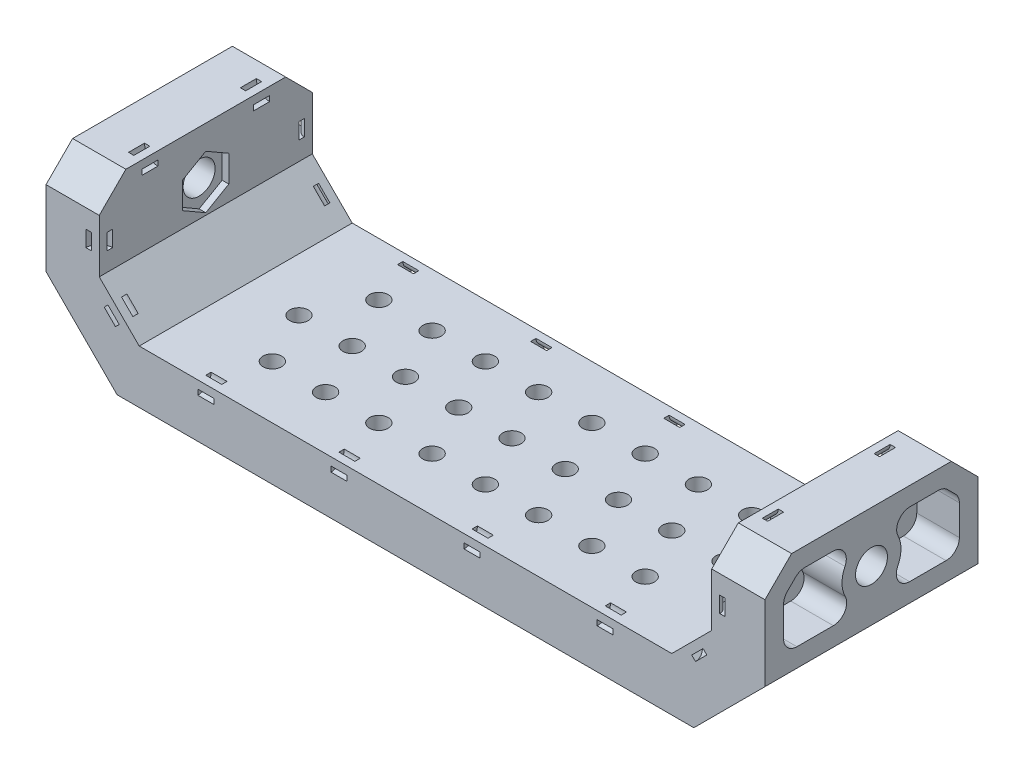
from build123d import *

# Parameters (mm, degrees)
EXTRUDE_1_DEPTH          = 40
EXTRUDE_1_DEPTH_BACK     = 40
CHAMFER_1_SIZE           = 10
SKETCH_2_R               = 3.5
CUT_EXTRUDE_3_DEPTH      = 30
CUT_EXTRUDE_8_DEPTH      = 12
SKETCH_6_R               = 6
CUT_EXTRUDE_9_DEPTH      = 22
CUT_EXTRUDE_10_DEPTH     = 2.5
CUT_EXTRUDE_11_DEPTH     = 16
CUT_EXTRUDE_12_DEPTH     = 17
CUT_EXTRUDE_13_DEPTH     = 8
SKETCH_10_W              = 6
SKETCH_10_H              = 2
SKETCH_12_W              = 2
SKETCH_12_H              = 6
SKETCH_13_W              = 2
SKETCH_13_H              = 6
MIRROR_4_COPY_2_SKETCH_W = 2
MIRROR_4_COPY_2_SKETCH_H = 6


with BuildPart() as part:
    # Эскиз1 → Бобышка-Вытянуть1 (new, two sides: drawn at the far end of the back side and taken through both)
    with BuildSketch(Plane.XY.offset(-EXTRUDE_1_DEPTH_BACK)):
        Polygon((-100, 0), (100, 0), (115, 15), (115, 45), (135, 45), (135, 6.715728753), (108.284271247, -20), (-108.284271247, -20), (-135, 6.715728753), (-135, 45), (-115, 45), (-115, 15), align=None)
    extrude(amount=EXTRUDE_1_DEPTH + EXTRUDE_1_DEPTH_BACK)

    # Фаска1
    chamfer_1_edges = [part.edges().sort_by_distance(p)[0] for p in [
        (125, 45, 40),
        (125, 45, -40),
        (-125, 45, -40),
        (-125, 45, 40),
    ]]
    chamfer(chamfer_1_edges, length=CHAMFER_1_SIZE)

    # Эскиз2 → Вырез-Вытянуть3 (cut)
    with BuildSketch(Plane(origin=(0, 0, 0), x_dir=(1, 0, 0), z_dir=(0, 1, 0))):
        Circle(SKETCH_2_R)
        with Locations((20, 0)):
            Circle(SKETCH_2_R)
        with Locations((40, 0)):
            Circle(SKETCH_2_R)
        with Locations((60, 0)):
            Circle(SKETCH_2_R)
        with Locations((80, 0)):
            Circle(SKETCH_2_R)
        with Locations((-20, 0)):
            Circle(SKETCH_2_R)
        with Locations((-40, 0)):
            Circle(SKETCH_2_R)
        with Locations((-60, 0)):
            Circle(SKETCH_2_R)
        with Locations((-80, 0)):
            Circle(SKETCH_2_R)
        with Locations((10, -20)):
            Circle(SKETCH_2_R)
        with Locations((30, -20)):
            Circle(SKETCH_2_R)
        with Locations((50, -20)):
            Circle(SKETCH_2_R)
        with Locations((70, -20)):
            Circle(SKETCH_2_R)
        with Locations((30, 20)):
            Circle(SKETCH_2_R)
        with Locations((50, 20)):
            Circle(SKETCH_2_R)
        with Locations((70, 20)):
            Circle(SKETCH_2_R)
        with Locations((10, 20)):
            Circle(SKETCH_2_R)
        with Locations((-70, 20)):
            Circle(SKETCH_2_R)
        with Locations((-50, 20)):
            Circle(SKETCH_2_R)
        with Locations((-30, 20)):
            Circle(SKETCH_2_R)
        with Locations((-10, 20)):
            Circle(SKETCH_2_R)
        with Locations((-10, -20)):
            Circle(SKETCH_2_R)
        with Locations((-30, -20)):
            Circle(SKETCH_2_R)
        with Locations((-50, -20)):
            Circle(SKETCH_2_R)
        with Locations((-70, -20)):
            Circle(SKETCH_2_R)
    extrude(amount=-CUT_EXTRUDE_3_DEPTH, mode=Mode.SUBTRACT)

    # Эскиз5 → Вырез-Вытянуть8 (cut)
    with BuildSketch(Plane(origin=(-64.142135624, -64.142135624, 0), x_dir=(0, 0, 1), z_dir=(-0.7071067811865483, -0.7071067811865468, 0))):
        with BuildLine():
            Line((-30, 93.208152802), (-5, 93.208152802))
            ThreePointArc((-5, 93.208152802), (-2.878679656, 92.329473145), (-2, 90.208152802))
            Line((-2, 90.208152802), (-2, 72.426406871))
            ThreePointArc((-2, 72.426406871), (-2.878679656, 70.305086528), (-5, 69.426406871))
            Line((-5, 69.426406871), (-30, 69.426406871))
            ThreePointArc((-30, 69.426406871), (-32.121320344, 70.305086528), (-33, 72.426406871))
            Line((-33, 72.426406871), (-33, 90.208152802))
            ThreePointArc((-33, 90.208152802), (-32.121320344, 92.329473145), (-30, 93.208152802))
        make_face()
        with BuildLine():
            Line((5, 93.208152802), (30, 93.208152802))
            ThreePointArc((30, 93.208152802), (32.121320344, 92.329473145), (33, 90.208152802))
            Line((33, 90.208152802), (33, 72.426406871))
            ThreePointArc((33, 72.426406871), (32.121320344, 70.305086528), (30, 69.426406871))
            Line((30, 69.426406871), (5, 69.426406871))
            ThreePointArc((5, 69.426406871), (2.878679656, 70.305086528), (2, 72.426406871))
            Line((2, 72.426406871), (2, 90.208152802))
            ThreePointArc((2, 90.208152802), (2.878679656, 92.329473145), (5, 93.208152802))
        make_face()
    cut_extrude_8 = extrude(amount=-CUT_EXTRUDE_8_DEPTH, mode=Mode.SUBTRACT)

    # Зеркальное отражение1: Вырез-Вытянуть8 across plane
    add(cut_extrude_8.mirror(Plane(origin=(0, 0, 0), x_dir=(0, 0, 1), z_dir=(1, 0, 0))), mode=Mode.SUBTRACT)

    # Эскиз6 → Вырез-Вытянуть9 (cut)
    with BuildSketch(Plane.ZY.offset(135)):
        with Locations((0, 26)):
            Circle(SKETCH_6_R)
    cut_extrude_9 = extrude(amount=-CUT_EXTRUDE_9_DEPTH, mode=Mode.SUBTRACT)

    # Эскиз7 → Вырез-Вытянуть10 (cut)
    with BuildSketch(Plane(origin=(-115, 0, 0), x_dir=(0, 0, -1), z_dir=(1, 0, 0))):
        Polygon((0, 35.857864376), (8.660254038, 30.857864376), (8.660254038, 20.857864376), (0, 15.857864376), (-8.660254038, 20.857864376), (-8.660254038, 30.857864376), align=None)
    cut_extrude_10 = extrude(amount=-CUT_EXTRUDE_10_DEPTH, mode=Mode.SUBTRACT)

    # Эскиз8 → Вырез-Вытянуть11 (cut)
    with BuildSketch(Plane.ZY.offset(135)):
        with BuildLine():
            Line((-25.029437252, 38), (-14.458578988, 38))
            ThreePointArc((-14.458578988, 38), (-10.222191502, 35.655752449), (-9.958260411, 30.821208428))
            ThreePointArc((-9.958260411, 30.821208428), (-11.063410697, 25.890707381), (-9.861071268, 20.983001438))
            ThreePointArc((-9.861071268, 20.983001438), (-10.055053298, 16.101954033), (-14.317468307, 13.715728753))
            Line((-14.317468307, 13.715728753), (-28, 13.715728753))
            ThreePointArc((-28, 13.715728753), (-31.535533906, 15.180194847), (-33, 18.715728753))
            Line((-33, 18.715728753), (-33, 30.029437252))
            ThreePointArc((-33, 30.029437252), (-32.619397663, 31.942854413), (-31.535533906, 33.564971157))
            Line((-31.535533906, 33.564971157), (-28.564971157, 36.535533906))
            ThreePointArc((-28.564971157, 36.535533906), (-26.942854413, 37.619397663), (-25.029437252, 38))
        make_face()
        with BuildLine():
            Line((14.458578988, 38), (25.029437252, 38))
            ThreePointArc((25.029437252, 38), (26.942854413, 37.619397663), (28.564971157, 36.535533906))
            Line((28.564971157, 36.535533906), (31.535533906, 33.564971157))
            ThreePointArc((31.535533906, 33.564971157), (32.619397663, 31.942854413), (33, 30.029437252))
            Line((33, 30.029437252), (33, 18.715728753))
            ThreePointArc((33, 18.715728753), (31.535533906, 15.180194847), (28, 13.715728753))
            Line((28, 13.715728753), (14.317468307, 13.715728753))
            ThreePointArc((14.317468307, 13.715728753), (10.055053298, 16.101954033), (9.861071268, 20.983001438))
            ThreePointArc((9.861071268, 20.983001438), (11.063410697, 25.890707381), (9.958260411, 30.821208428))
            ThreePointArc((9.958260411, 30.821208428), (10.222191502, 35.655752449), (14.458578988, 38))
        make_face()
    cut_extrude_11 = extrude(amount=-CUT_EXTRUDE_11_DEPTH, mode=Mode.SUBTRACT)

    # Зеркальное отражение2: Вырез-Вытянуть9, Вырез-Вытянуть10, Вырез-Вытянуть11 across plane
    add(cut_extrude_9.mirror(Plane(origin=(0, 0, 0), x_dir=(0, 0, 1), z_dir=(1, 0, 0))), mode=Mode.SUBTRACT)
    add(cut_extrude_10.mirror(Plane(origin=(0, 0, 0), x_dir=(0, 0, 1), z_dir=(1, 0, 0))), mode=Mode.SUBTRACT)
    add(cut_extrude_11.mirror(Plane(origin=(0, 0, 0), x_dir=(0, 0, 1), z_dir=(1, 0, 0))), mode=Mode.SUBTRACT)

    # Эскиз3 → Вырез-Вытянуть12 (cut)
    with BuildSketch(Plane.XZ.offset(20)):
        with BuildLine():
            Line((-90.284271247, 33), (-80.590169944, 33))
            ThreePointArc((-80.590169944, 33), (-79.012976607, 32.551952425), (-77.906888371, 31.341640786))
            Line((-77.906888371, 31.341640786), (-75.135494488, 25.798853021))
            ThreePointArc((-75.135494488, 25.798853021), (-74.819888616, 24.375517127), (-75.212517374, 22.971474823))
            ThreePointArc((-75.212517374, 22.971474823), (-76, 20), (-75.212517374, 17.028525177))
            ThreePointArc((-75.212517374, 17.028525177), (-74.819888616, 15.624482873), (-75.135494488, 14.201146979))
            Line((-75.135494488, 14.201146979), (-78.442214276, 7.587707403))
            ThreePointArc((-78.442214276, 7.587707403), (-79.391519468, 6.481221169), (-80.750330566, 5.952898793))
            ThreePointArc((-80.750330566, 5.952898793), (-83.154386673, 5.10390485), (-84.988876516, 3.333333333))
            ThreePointArc((-84.988876516, 3.333333333), (-86.069101211, 2.354248689), (-87.483314774, 2))
            Line((-87.483314774, 2), (-98.284271247, 2))
            ThreePointArc((-98.284271247, 2), (-100.405591591, 2.878679656), (-101.284271247, 5))
            Line((-101.284271247, 5), (-101.284271247, 22))
            ThreePointArc((-101.284271247, 22), (-98.062445841, 29.778174593), (-90.284271247, 33))
        make_face()
        with BuildLine():
            Line((-71.788854382, 28.049844719), (-74.263932023, 33))
            Line((-74.263932023, 33), (-65.736067977, 33))
            Line((-65.736067977, 33), (-68.211145618, 28.049844719))
            ThreePointArc((-68.211145618, 28.049844719), (-70, 26.94427191), (-71.788854382, 28.049844719))
        make_face()
        with BuildLine():
            Line((-61.788854382, 31.950155281), (-64.864505512, 25.798853021))
            ThreePointArc((-64.864505512, 25.798853021), (-65.180111384, 24.375517127), (-64.787482626, 22.971474823))
            ThreePointArc((-64.787482626, 22.971474823), (-64, 20), (-64.787482626, 17.028525177))
            ThreePointArc((-64.787482626, 17.028525177), (-65.180111384, 15.624482873), (-64.864505512, 14.201146979))
            Line((-64.864505512, 14.201146979), (-61.788854382, 8.049844719))
            ThreePointArc((-61.788854382, 8.049844719), (-60, 6.94427191), (-58.211145618, 8.049844719))
            Line((-58.211145618, 8.049844719), (-55.135494488, 14.201146979))
            ThreePointArc((-55.135494488, 14.201146979), (-54.819888616, 15.624482873), (-55.212517374, 17.028525177))
            ThreePointArc((-55.212517374, 17.028525177), (-56, 20), (-55.212517374, 22.971474823))
            ThreePointArc((-55.212517374, 22.971474823), (-54.819888616, 24.375517127), (-55.135494488, 25.798853021))
            Line((-55.135494488, 25.798853021), (-58.211145618, 31.950155281))
            ThreePointArc((-58.211145618, 31.950155281), (-60, 33.05572809), (-61.788854382, 31.950155281))
        make_face()
        with BuildLine():
            Line((-71.788854382, 11.950155281), (-74.593111629, 6.341640786))
            ThreePointArc((-74.593111629, 6.341640786), (-74.461782481, 3.422806664), (-71.909830056, 2))
            Line((-71.909830056, 2), (-68.090169944, 2))
            ThreePointArc((-68.090169944, 2), (-65.538217519, 3.422806664), (-65.406888371, 6.341640786))
            Line((-65.406888371, 6.341640786), (-68.211145618, 11.950155281))
            ThreePointArc((-68.211145618, 11.950155281), (-70, 13.05572809), (-71.788854382, 11.950155281))
        make_face()
        with BuildLine():
            Line((-78.442214276, -7.587707403), (-75.135494488, -14.201146979))
            ThreePointArc((-75.135494488, -14.201146979), (-74.819888616, -15.624482873), (-75.212517374, -17.028525177))
            ThreePointArc((-75.212517374, -17.028525177), (-76, -20), (-75.212517374, -22.971474823))
            ThreePointArc((-75.212517374, -22.971474823), (-74.819888616, -24.375517127), (-75.135494488, -25.798853021))
            Line((-75.135494488, -25.798853021), (-78.736067978, -33))
            Line((-78.736067978, -33), (-90.284271247, -33))
            ThreePointArc((-90.284271247, -33), (-98.062445841, -29.778174593), (-101.284271247, -22))
            Line((-101.284271247, -22), (-101.284271247, -5))
            ThreePointArc((-101.284271247, -5), (-100.405591591, -2.878679656), (-98.284271247, -2))
            Line((-98.284271247, -2), (-87.483314774, -2))
            ThreePointArc((-87.483314774, -2), (-86.069101211, -2.354248689), (-84.988876516, -3.333333333))
            ThreePointArc((-84.988876516, -3.333333333), (-83.154386673, -5.10390485), (-80.750330566, -5.952898793))
            ThreePointArc((-80.750330566, -5.952898793), (-79.391519468, -6.481221169), (-78.442214276, -7.587707403))
        make_face()
        with BuildLine():
            Line((-74.593111629, -6.341640786), (-71.788854382, -11.950155281))
            ThreePointArc((-71.788854382, -11.950155281), (-70, -13.05572809), (-68.211145618, -11.950155281))
            Line((-68.211145618, -11.950155281), (-65.406888371, -6.341640787))
            ThreePointArc((-65.406888371, -6.341640787), (-65.538217519, -3.422806664), (-68.090169944, -2))
            Line((-68.090169944, -2), (-71.909830056, -2))
            ThreePointArc((-71.909830056, -2), (-74.461782481, -3.422806664), (-74.593111629, -6.341640786))
        make_face()
        with BuildLine():
            Line((-61.788854382, -8.049844719), (-64.864505512, -14.201146979))
            ThreePointArc((-64.864505512, -14.201146979), (-65.180111384, -15.624482873), (-64.787482626, -17.028525177))
            ThreePointArc((-64.787482626, -17.028525177), (-64, -20), (-64.787482626, -22.971474823))
            ThreePointArc((-64.787482626, -22.971474823), (-65.180111384, -24.375517127), (-64.864505512, -25.798853021))
            Line((-64.864505512, -25.798853021), (-61.788854382, -31.950155281))
            ThreePointArc((-61.788854382, -31.950155281), (-60, -33.05572809), (-58.211145618, -31.950155281))
            Line((-58.211145618, -31.950155281), (-55.135494488, -25.798853021))
            ThreePointArc((-55.135494488, -25.798853021), (-54.819888616, -24.375517127), (-55.212517374, -22.971474823))
            ThreePointArc((-55.212517374, -22.971474823), (-56, -20), (-55.212517374, -17.028525177))
            ThreePointArc((-55.212517374, -17.028525177), (-54.819888616, -15.624482873), (-55.135494488, -14.201146979))
            Line((-55.135494488, -14.201146979), (-58.211145618, -8.049844719))
            ThreePointArc((-58.211145618, -8.049844719), (-60, -6.94427191), (-61.788854382, -8.049844719))
        make_face()
        with BuildLine():
            Line((-68.211145618, -28.049844719), (-65.736067978, -33))
            Line((-65.736067978, -33), (-74.263932023, -33))
            Line((-74.263932023, -33), (-71.788854382, -28.049844719))
            ThreePointArc((-71.788854382, -28.049844719), (-70, -26.94427191), (-68.211145618, -28.049844719))
        make_face()
        with BuildLine():
            Line((-51.788854382, -28.049844719), (-54.263932023, -33))
            Line((-54.263932023, -33), (-45.736067977, -33))
            Line((-45.736067977, -33), (-48.211145618, -28.049844719))
            ThreePointArc((-48.211145618, -28.049844719), (-50, -26.94427191), (-51.788854382, -28.049844719))
        make_face()
        with BuildLine():
            Line((-51.788854382, -11.950155281), (-54.593111629, -6.341640787))
            ThreePointArc((-54.593111629, -6.341640787), (-54.461782481, -3.422806664), (-51.909830056, -2))
            Line((-51.909830056, -2), (-48.090169944, -2))
            ThreePointArc((-48.090169944, -2), (-45.538217519, -3.422806664), (-45.406888371, -6.341640786))
            Line((-45.406888371, -6.341640786), (-48.211145618, -11.950155281))
            ThreePointArc((-48.211145618, -11.950155281), (-50, -13.05572809), (-51.788854382, -11.950155281))
        make_face()
        with BuildLine():
            Line((-51.788854382, 11.950155281), (-54.593111629, 6.341640787))
            ThreePointArc((-54.593111629, 6.341640787), (-54.461782481, 3.422806664), (-51.909830056, 2))
            Line((-51.909830056, 2), (-48.090169944, 2))
            ThreePointArc((-48.090169944, 2), (-45.538217519, 3.422806664), (-45.406888371, 6.341640786))
            Line((-45.406888371, 6.341640786), (-48.211145618, 11.950155281))
            ThreePointArc((-48.211145618, 11.950155281), (-50, 13.05572809), (-51.788854382, 11.950155281))
        make_face()
        with BuildLine():
            Line((-51.788854382, 28.049844719), (-54.263932023, 33))
            Line((-54.263932023, 33), (-45.736067977, 33))
            Line((-45.736067977, 33), (-48.211145618, 28.049844719))
            ThreePointArc((-48.211145618, 28.049844719), (-50, 26.94427191), (-51.788854382, 28.049844719))
        make_face()
        with BuildLine():
            Line((-41.788854382, 31.950155281), (-44.864505512, 25.798853021))
            ThreePointArc((-44.864505512, 25.798853021), (-45.180111384, 24.375517127), (-44.787482626, 22.971474823))
            ThreePointArc((-44.787482626, 22.971474823), (-44, 20), (-44.787482626, 17.028525177))
            ThreePointArc((-44.787482626, 17.028525177), (-45.180111384, 15.624482873), (-44.864505512, 14.201146979))
            Line((-44.864505512, 14.201146979), (-41.788854382, 8.049844719))
            ThreePointArc((-41.788854382, 8.049844719), (-40, 6.94427191), (-38.211145618, 8.049844719))
            Line((-38.211145618, 8.049844719), (-35.135494488, 14.201146979))
            ThreePointArc((-35.135494488, 14.201146979), (-34.819888616, 15.624482873), (-35.212517374, 17.028525177))
            ThreePointArc((-35.212517374, 17.028525177), (-36, 20), (-35.212517374, 22.971474823))
            ThreePointArc((-35.212517374, 22.971474823), (-34.819888616, 24.375517127), (-35.135494488, 25.798853021))
            Line((-35.135494488, 25.798853021), (-38.211145618, 31.950155281))
            ThreePointArc((-38.211145618, 31.950155281), (-40, 33.05572809), (-41.788854382, 31.950155281))
        make_face()
        with BuildLine():
            Line((-31.788854382, 28.049844719), (-34.263932023, 33))
            Line((-34.263932023, 33), (-25.736067978, 33))
            Line((-25.736067978, 33), (-28.211145618, 28.049844719))
            ThreePointArc((-28.211145618, 28.049844719), (-30, 26.94427191), (-31.788854382, 28.049844719))
        make_face()
        with BuildLine():
            Line((-21.788854382, 31.950155281), (-24.864505512, 25.798853021))
            ThreePointArc((-24.864505512, 25.798853021), (-25.180111384, 24.375517127), (-24.787482626, 22.971474823))
            ThreePointArc((-24.787482626, 22.971474823), (-24, 20), (-24.787482626, 17.028525177))
            ThreePointArc((-24.787482626, 17.028525177), (-25.180111384, 15.624482873), (-24.864505512, 14.201146979))
            Line((-24.864505512, 14.201146979), (-21.788854382, 8.049844719))
            ThreePointArc((-21.788854382, 8.049844719), (-20, 6.94427191), (-18.211145618, 8.049844719))
            Line((-18.211145618, 8.049844719), (-15.135494488, 14.201146979))
            ThreePointArc((-15.135494488, 14.201146979), (-14.819888616, 15.624482873), (-15.212517374, 17.028525177))
            ThreePointArc((-15.212517374, 17.028525177), (-16, 20), (-15.212517374, 22.971474823))
            ThreePointArc((-15.212517374, 22.971474823), (-14.819888616, 24.375517127), (-15.135494488, 25.798853021))
            Line((-15.135494488, 25.798853021), (-18.211145618, 31.950155281))
            ThreePointArc((-18.211145618, 31.950155281), (-20, 33.05572809), (-21.788854382, 31.950155281))
        make_face()
        with BuildLine():
            Line((-25.406888371, 6.341640786), (-28.211145618, 11.950155281))
            ThreePointArc((-28.211145618, 11.950155281), (-30, 13.05572809), (-31.788854382, 11.950155281))
            Line((-31.788854382, 11.950155281), (-34.593111629, 6.341640787))
            ThreePointArc((-34.593111629, 6.341640787), (-34.461782481, 3.422806664), (-31.909830056, 2))
            Line((-31.909830056, 2), (-28.090169944, 2))
            ThreePointArc((-28.090169944, 2), (-25.538217519, 3.422806664), (-25.406888371, 6.341640786))
        make_face()
        with BuildLine():
            Line((-31.788854382, -11.950155281), (-34.593111629, -6.341640787))
            ThreePointArc((-34.593111629, -6.341640787), (-34.461782481, -3.422806664), (-31.909830056, -2))
            Line((-31.909830056, -2), (-28.090169944, -2))
            ThreePointArc((-28.090169944, -2), (-25.538217519, -3.422806664), (-25.406888371, -6.341640787))
            Line((-25.406888371, -6.341640787), (-28.211145618, -11.950155281))
            ThreePointArc((-28.211145618, -11.950155281), (-30, -13.05572809), (-31.788854382, -11.950155281))
        make_face()
        with BuildLine():
            Line((-35.135494488, -14.201146979), (-38.211145618, -8.049844719))
            ThreePointArc((-38.211145618, -8.049844719), (-40, -6.94427191), (-41.788854382, -8.049844719))
            Line((-41.788854382, -8.049844719), (-44.864505512, -14.201146979))
            ThreePointArc((-44.864505512, -14.201146979), (-45.180111384, -15.624482873), (-44.787482626, -17.028525177))
            ThreePointArc((-44.787482626, -17.028525177), (-44, -20), (-44.787482626, -22.971474823))
            ThreePointArc((-44.787482626, -22.971474823), (-45.180111384, -24.375517127), (-44.864505512, -25.798853021))
            Line((-44.864505512, -25.798853021), (-41.788854382, -31.950155281))
            ThreePointArc((-41.788854382, -31.950155281), (-40, -33.05572809), (-38.211145618, -31.950155281))
            Line((-38.211145618, -31.950155281), (-35.135494488, -25.798853021))
            ThreePointArc((-35.135494488, -25.798853021), (-34.819888616, -24.375517127), (-35.212517374, -22.971474823))
            ThreePointArc((-35.212517374, -22.971474823), (-36, -20), (-35.212517374, -17.028525177))
            ThreePointArc((-35.212517374, -17.028525177), (-34.819888616, -15.624482873), (-35.135494488, -14.201146979))
        make_face()
        with BuildLine():
            Line((-31.788854382, -28.049844719), (-34.263932023, -33))
            Line((-34.263932023, -33), (-25.736067978, -33))
            Line((-25.736067978, -33), (-28.211145618, -28.049844719))
            ThreePointArc((-28.211145618, -28.049844719), (-30, -26.94427191), (-31.788854382, -28.049844719))
        make_face()
        with BuildLine():
            Line((-21.788854382, -31.950155281), (-24.864505512, -25.798853021))
            ThreePointArc((-24.864505512, -25.798853021), (-25.180111384, -24.375517127), (-24.787482626, -22.971474823))
            ThreePointArc((-24.787482626, -22.971474823), (-24, -20), (-24.787482626, -17.028525177))
            ThreePointArc((-24.787482626, -17.028525177), (-25.180111384, -15.624482873), (-24.864505512, -14.201146979))
            Line((-24.864505512, -14.201146979), (-21.788854382, -8.049844719))
            ThreePointArc((-21.788854382, -8.049844719), (-20, -6.94427191), (-18.211145618, -8.049844719))
            Line((-18.211145618, -8.049844719), (-15.135494488, -14.201146979))
            ThreePointArc((-15.135494488, -14.201146979), (-14.819888616, -15.624482873), (-15.212517374, -17.028525177))
            ThreePointArc((-15.212517374, -17.028525177), (-16, -20), (-15.212517374, -22.971474823))
            ThreePointArc((-15.212517374, -22.971474823), (-14.819888616, -24.375517127), (-15.135494488, -25.798853021))
            Line((-15.135494488, -25.798853021), (-18.211145618, -31.950155281))
            ThreePointArc((-18.211145618, -31.950155281), (-20, -33.05572809), (-21.788854382, -31.950155281))
        make_face()
        with BuildLine():
            Line((-11.788854382, 11.950155281), (-14.593111629, 6.341640787))
            ThreePointArc((-14.593111629, 6.341640787), (-14.461782481, 3.422806664), (-11.909830056, 2))
            Line((-11.909830056, 2), (-8.090169944, 2))
            ThreePointArc((-8.090169944, 2), (-5.538217519, 3.422806664), (-5.406888371, 6.341640787))
            Line((-5.406888371, 6.341640787), (-8.211145618, 11.950155281))
            ThreePointArc((-8.211145618, 11.950155281), (-10, 13.05572809), (-11.788854382, 11.950155281))
        make_face()
        with BuildLine():
            Line((-11.788854382, -11.950155281), (-14.593111629, -6.341640787))
            ThreePointArc((-14.593111629, -6.341640787), (-14.461782481, -3.422806664), (-11.909830056, -2))
            Line((-11.909830056, -2), (-8.090169944, -2))
            ThreePointArc((-8.090169944, -2), (-5.538217519, -3.422806664), (-5.406888371, -6.341640787))
            Line((-5.406888371, -6.341640787), (-8.211145618, -11.950155281))
            ThreePointArc((-8.211145618, -11.950155281), (-10, -13.05572809), (-11.788854382, -11.950155281))
        make_face()
        with BuildLine():
            Line((-11.788854382, -28.049844719), (-14.263932023, -33))
            Line((-14.263932023, -33), (-5.736067978, -33))
            Line((-5.736067978, -33), (-8.211145618, -28.049844719))
            ThreePointArc((-8.211145618, -28.049844719), (-10, -26.94427191), (-11.788854382, -28.049844719))
        make_face()
        with BuildLine():
            Line((-11.788854382, 28.049844719), (-14.263932023, 33))
            Line((-14.263932023, 33), (-5.736067978, 33))
            Line((-5.736067978, 33), (-8.211145618, 28.049844719))
            ThreePointArc((-8.211145618, 28.049844719), (-10, 26.94427191), (-11.788854382, 28.049844719))
        make_face()
        with BuildLine():
            Line((-1.788854382, 31.950155281), (-4.864505512, 25.798853021))
            ThreePointArc((-4.864505512, 25.798853021), (-5.180111384, 24.375517127), (-4.787482626, 22.971474823))
            ThreePointArc((-4.787482626, 22.971474823), (-4, 20), (-4.787482626, 17.028525177))
            ThreePointArc((-4.787482626, 17.028525177), (-5.180111384, 15.624482873), (-4.864505512, 14.201146979))
            Line((-4.864505512, 14.201146979), (-1.788854382, 8.049844719))
            ThreePointArc((-1.788854382, 8.049844719), (0, 6.94427191), (1.788854382, 8.049844719))
            Line((1.788854382, 8.049844719), (4.864505512, 14.201146979))
            ThreePointArc((4.864505512, 14.201146979), (5.180111384, 15.624482873), (4.787482626, 17.028525177))
            ThreePointArc((4.787482626, 17.028525177), (4, 20), (4.787482626, 22.971474823))
            ThreePointArc((4.787482626, 22.971474823), (5.180111384, 24.375517127), (4.864505512, 25.798853021))
            Line((4.864505512, 25.798853021), (1.788854382, 31.950155281))
            ThreePointArc((1.788854382, 31.950155281), (0, 33.05572809), (-1.788854382, 31.950155281))
        make_face()
        with BuildLine():
            Line((8.211145618, 28.049844719), (5.736067977, 33))
            Line((5.736067977, 33), (14.263932022, 33))
            Line((14.263932022, 33), (11.788854382, 28.049844719))
            ThreePointArc((11.788854382, 28.049844719), (10, 26.94427191), (8.211145618, 28.049844719))
        make_face()
        with BuildLine():
            Line((8.211145618, 11.950155281), (5.406888371, 6.341640787))
            ThreePointArc((5.406888371, 6.341640787), (5.538217519, 3.422806664), (8.090169944, 2))
            Line((8.090169944, 2), (11.909830056, 2))
            ThreePointArc((11.909830056, 2), (14.461782481, 3.422806664), (14.593111629, 6.341640787))
            Line((14.593111629, 6.341640787), (11.788854382, 11.950155281))
            ThreePointArc((11.788854382, 11.950155281), (10, 13.05572809), (8.211145618, 11.950155281))
        make_face()
        with BuildLine():
            Line((8.211145618, -11.950155281), (5.406888371, -6.341640787))
            ThreePointArc((5.406888371, -6.341640787), (5.538217519, -3.422806664), (8.090169944, -2))
            Line((8.090169944, -2), (11.909830056, -2))
            ThreePointArc((11.909830056, -2), (14.461782481, -3.422806664), (14.593111629, -6.341640787))
            Line((14.593111629, -6.341640787), (11.788854382, -11.950155281))
            ThreePointArc((11.788854382, -11.950155281), (10, -13.05572809), (8.211145618, -11.950155281))
        make_face()
        with BuildLine():
            Line((4.864505512, -14.201146979), (1.788854382, -8.049844719))
            ThreePointArc((1.788854382, -8.049844719), (0, -6.94427191), (-1.788854382, -8.049844719))
            Line((-1.788854382, -8.049844719), (-4.864505512, -14.201146979))
            ThreePointArc((-4.864505512, -14.201146979), (-5.180111384, -15.624482873), (-4.787482626, -17.028525177))
            ThreePointArc((-4.787482626, -17.028525177), (-4, -20), (-4.787482626, -22.971474823))
            ThreePointArc((-4.787482626, -22.971474823), (-5.180111384, -24.375517127), (-4.864505512, -25.798853021))
            Line((-4.864505512, -25.798853021), (-1.788854382, -31.950155281))
            ThreePointArc((-1.788854382, -31.950155281), (0, -33.05572809), (1.788854382, -31.950155281))
            Line((1.788854382, -31.950155281), (4.864505512, -25.798853021))
            ThreePointArc((4.864505512, -25.798853021), (5.180111384, -24.375517127), (4.787482626, -22.971474823))
            ThreePointArc((4.787482626, -22.971474823), (4, -20), (4.787482626, -17.028525177))
            ThreePointArc((4.787482626, -17.028525177), (5.180111384, -15.624482873), (4.864505512, -14.201146979))
        make_face()
        with BuildLine():
            Line((8.211145618, -28.049844719), (5.736067977, -33))
            Line((5.736067977, -33), (14.263932022, -33))
            Line((14.263932022, -33), (11.788854382, -28.049844719))
            ThreePointArc((11.788854382, -28.049844719), (10, -26.94427191), (8.211145618, -28.049844719))
        make_face()
        with BuildLine():
            Line((18.211145618, -8.049844719), (15.135494488, -14.201146979))
            ThreePointArc((15.135494488, -14.201146979), (14.819888616, -15.624482873), (15.212517374, -17.028525177))
            ThreePointArc((15.212517374, -17.028525177), (16, -20), (15.212517374, -22.971474823))
            ThreePointArc((15.212517374, -22.971474823), (14.819888616, -24.375517127), (15.135494488, -25.798853021))
            Line((15.135494488, -25.798853021), (18.211145618, -31.950155281))
            ThreePointArc((18.211145618, -31.950155281), (20, -33.05572809), (21.788854382, -31.950155281))
            Line((21.788854382, -31.950155281), (24.864505512, -25.798853021))
            ThreePointArc((24.864505512, -25.798853021), (25.180111384, -24.375517127), (24.787482626, -22.971474823))
            ThreePointArc((24.787482626, -22.971474823), (24, -20), (24.787482626, -17.028525177))
            ThreePointArc((24.787482626, -17.028525177), (25.180111384, -15.624482873), (24.864505512, -14.201146979))
            Line((24.864505512, -14.201146979), (21.788854382, -8.049844719))
            ThreePointArc((21.788854382, -8.049844719), (20, -6.94427191), (18.211145618, -8.049844719))
        make_face()
        with BuildLine():
            Line((18.211145618, 31.950155281), (15.135494488, 25.798853021))
            ThreePointArc((15.135494488, 25.798853021), (14.819888616, 24.375517127), (15.212517374, 22.971474823))
            ThreePointArc((15.212517374, 22.971474823), (16, 20), (15.212517374, 17.028525177))
            ThreePointArc((15.212517374, 17.028525177), (14.819888616, 15.624482873), (15.135494488, 14.201146979))
            Line((15.135494488, 14.201146979), (18.211145618, 8.049844719))
            ThreePointArc((18.211145618, 8.049844719), (20, 6.94427191), (21.788854382, 8.049844719))
            Line((21.788854382, 8.049844719), (24.864505512, 14.201146979))
            ThreePointArc((24.864505512, 14.201146979), (25.180111384, 15.624482873), (24.787482626, 17.028525177))
            ThreePointArc((24.787482626, 17.028525177), (24, 20), (24.787482626, 22.971474823))
            ThreePointArc((24.787482626, 22.971474823), (25.180111384, 24.375517127), (24.864505512, 25.798853021))
            Line((24.864505512, 25.798853021), (21.788854382, 31.950155281))
            ThreePointArc((21.788854382, 31.950155281), (20, 33.05572809), (18.211145618, 31.950155281))
        make_face()
        with BuildLine():
            Line((28.211145618, 28.049844719), (25.736067977, 33))
            Line((25.736067977, 33), (34.263932022, 33))
            Line((34.263932022, 33), (31.788854382, 28.049844719))
            ThreePointArc((31.788854382, 28.049844719), (30, 26.94427191), (28.211145618, 28.049844719))
        make_face()
        with BuildLine():
            Line((28.211145618, 11.950155281), (25.406888371, 6.341640787))
            ThreePointArc((25.406888371, 6.341640787), (25.538217519, 3.422806664), (28.090169944, 2))
            Line((28.090169944, 2), (31.909830056, 2))
            ThreePointArc((31.909830056, 2), (34.461782481, 3.422806664), (34.593111629, 6.341640787))
            Line((34.593111629, 6.341640787), (31.788854382, 11.950155281))
            ThreePointArc((31.788854382, 11.950155281), (30, 13.05572809), (28.211145618, 11.950155281))
        make_face()
        with BuildLine():
            Line((28.211145618, -11.950155281), (25.406888371, -6.341640787))
            ThreePointArc((25.406888371, -6.341640787), (25.538217519, -3.422806664), (28.090169944, -2))
            Line((28.090169944, -2), (31.909830056, -2))
            ThreePointArc((31.909830056, -2), (34.461782481, -3.422806664), (34.593111629, -6.341640787))
            Line((34.593111629, -6.341640787), (31.788854382, -11.950155281))
            ThreePointArc((31.788854382, -11.950155281), (30, -13.05572809), (28.211145618, -11.950155281))
        make_face()
        with BuildLine():
            Line((28.211145618, -28.049844719), (25.736067977, -33))
            Line((25.736067977, -33), (34.263932022, -33))
            Line((34.263932022, -33), (31.788854382, -28.049844719))
            ThreePointArc((31.788854382, -28.049844719), (30, -26.94427191), (28.211145618, -28.049844719))
        make_face()
        with BuildLine():
            Line((38.211145618, -31.950155281), (35.135494488, -25.798853021))
            ThreePointArc((35.135494488, -25.798853021), (34.819888616, -24.375517127), (35.212517374, -22.971474823))
            ThreePointArc((35.212517374, -22.971474823), (36, -20), (35.212517374, -17.028525177))
            ThreePointArc((35.212517374, -17.028525177), (34.819888616, -15.624482873), (35.135494488, -14.201146979))
            Line((35.135494488, -14.201146979), (38.211145618, -8.049844719))
            ThreePointArc((38.211145618, -8.049844719), (40, -6.94427191), (41.788854382, -8.049844719))
            Line((41.788854382, -8.049844719), (44.864505512, -14.201146979))
            ThreePointArc((44.864505512, -14.201146979), (45.180111384, -15.624482873), (44.787482626, -17.028525177))
            ThreePointArc((44.787482626, -17.028525177), (44, -20), (44.787482626, -22.971474823))
            ThreePointArc((44.787482626, -22.971474823), (45.180111384, -24.375517127), (44.864505512, -25.798853021))
            Line((44.864505512, -25.798853021), (41.788854382, -31.950155281))
            ThreePointArc((41.788854382, -31.950155281), (40, -33.05572809), (38.211145618, -31.950155281))
        make_face()
        with BuildLine():
            Line((48.211145618, -28.049844719), (45.736067977, -33))
            Line((45.736067977, -33), (54.263932022, -33))
            Line((54.263932022, -33), (51.788854382, -28.049844719))
            ThreePointArc((51.788854382, -28.049844719), (50, -26.94427191), (48.211145618, -28.049844719))
        make_face()
        with BuildLine():
            Line((58.211145618, -31.950155281), (55.135494488, -25.798853021))
            ThreePointArc((55.135494488, -25.798853021), (54.819888616, -24.375517127), (55.212517374, -22.971474823))
            ThreePointArc((55.212517374, -22.971474823), (56, -20), (55.212517374, -17.028525177))
            ThreePointArc((55.212517374, -17.028525177), (54.819888616, -15.624482873), (55.135494488, -14.201146979))
            Line((55.135494488, -14.201146979), (58.211145618, -8.049844719))
            ThreePointArc((58.211145618, -8.049844719), (60, -6.94427191), (61.788854382, -8.049844719))
            Line((61.788854382, -8.049844719), (64.864505512, -14.201146979))
            ThreePointArc((64.864505512, -14.201146979), (65.180111384, -15.624482873), (64.787482626, -17.028525177))
            ThreePointArc((64.787482626, -17.028525177), (64, -20), (64.787482626, -22.971474823))
            ThreePointArc((64.787482626, -22.971474823), (65.180111384, -24.375517127), (64.864505512, -25.798853021))
            Line((64.864505512, -25.798853021), (61.788854382, -31.950155281))
            ThreePointArc((61.788854382, -31.950155281), (60, -33.05572809), (58.211145618, -31.950155281))
        make_face()
        with BuildLine():
            Line((68.211145618, -28.049844719), (65.736067977, -33))
            Line((65.736067977, -33), (74.263932022, -33))
            Line((74.263932022, -33), (71.788854382, -28.049844719))
            ThreePointArc((71.788854382, -28.049844719), (70, -26.94427191), (68.211145618, -28.049844719))
        make_face()
        with BuildLine():
            Line((68.211145618, -11.950155281), (65.406888371, -6.341640787))
            ThreePointArc((65.406888371, -6.341640787), (65.538217519, -3.422806664), (68.090169944, -2))
            Line((68.090169944, -2), (71.909830056, -2))
            ThreePointArc((71.909830056, -2), (74.461782481, -3.422806664), (74.593111629, -6.341640787))
            Line((74.593111629, -6.341640787), (71.788854382, -11.950155281))
            ThreePointArc((71.788854382, -11.950155281), (70, -13.05572809), (68.211145618, -11.950155281))
        make_face()
        with BuildLine():
            Line((54.593111629, -6.341640787), (51.788854382, -11.950155281))
            ThreePointArc((51.788854382, -11.950155281), (50, -13.05572809), (48.211145618, -11.950155281))
            Line((48.211145618, -11.950155281), (45.406888371, -6.341640787))
            ThreePointArc((45.406888371, -6.341640787), (45.538217519, -3.422806664), (48.090169944, -2))
            Line((48.090169944, -2), (51.909830056, -2))
            ThreePointArc((51.909830056, -2), (54.461782481, -3.422806664), (54.593111629, -6.341640787))
        make_face()
        with BuildLine():
            Line((48.211145618, 11.950155281), (45.406888371, 6.341640787))
            ThreePointArc((45.406888371, 6.341640787), (45.538217519, 3.422806664), (48.090169944, 2))
            Line((48.090169944, 2), (51.909830056, 2))
            ThreePointArc((51.909830056, 2), (54.461782481, 3.422806664), (54.593111629, 6.341640787))
            Line((54.593111629, 6.341640787), (51.788854382, 11.950155281))
            ThreePointArc((51.788854382, 11.950155281), (50, 13.05572809), (48.211145618, 11.950155281))
        make_face()
        with BuildLine():
            Line((44.864505512, 14.201146979), (41.788854382, 8.049844719))
            ThreePointArc((41.788854382, 8.049844719), (40, 6.94427191), (38.211145618, 8.049844719))
            Line((38.211145618, 8.049844719), (35.135494488, 14.201146979))
            ThreePointArc((35.135494488, 14.201146979), (34.819888616, 15.624482873), (35.212517374, 17.028525177))
            ThreePointArc((35.212517374, 17.028525177), (36, 20), (35.212517374, 22.971474823))
            ThreePointArc((35.212517374, 22.971474823), (34.819888616, 24.375517127), (35.135494488, 25.798853021))
            Line((35.135494488, 25.798853021), (38.211145618, 31.950155281))
            ThreePointArc((38.211145618, 31.950155281), (40, 33.05572809), (41.788854382, 31.950155281))
            Line((41.788854382, 31.950155281), (44.864505512, 25.798853021))
            ThreePointArc((44.864505512, 25.798853021), (45.180111384, 24.375517127), (44.787482626, 22.971474823))
            ThreePointArc((44.787482626, 22.971474823), (44, 20), (44.787482626, 17.028525177))
            ThreePointArc((44.787482626, 17.028525177), (45.180111384, 15.624482873), (44.864505512, 14.201146979))
        make_face()
        with BuildLine():
            Line((48.211145618, 28.049844719), (45.736067977, 33))
            Line((45.736067977, 33), (54.263932022, 33))
            Line((54.263932022, 33), (51.788854382, 28.049844719))
            ThreePointArc((51.788854382, 28.049844719), (50, 26.94427191), (48.211145618, 28.049844719))
        make_face()
        with BuildLine():
            Line((64.864505512, 25.798853021), (61.788854382, 31.950155281))
            ThreePointArc((61.788854382, 31.950155281), (60, 33.05572809), (58.211145618, 31.950155281))
            Line((58.211145618, 31.950155281), (55.135494488, 25.798853021))
            ThreePointArc((55.135494488, 25.798853021), (54.819888616, 24.375517127), (55.212517374, 22.971474823))
            ThreePointArc((55.212517374, 22.971474823), (56, 20), (55.212517374, 17.028525177))
            ThreePointArc((55.212517374, 17.028525177), (54.819888616, 15.624482873), (55.135494488, 14.201146979))
            Line((55.135494488, 14.201146979), (58.211145618, 8.049844719))
            ThreePointArc((58.211145618, 8.049844719), (60, 6.94427191), (61.788854382, 8.049844719))
            Line((61.788854382, 8.049844719), (64.864505512, 14.201146979))
            ThreePointArc((64.864505512, 14.201146979), (65.180111384, 15.624482873), (64.787482626, 17.028525177))
            ThreePointArc((64.787482626, 17.028525177), (64, 20), (64.787482626, 22.971474823))
            ThreePointArc((64.787482626, 22.971474823), (65.180111384, 24.375517127), (64.864505512, 25.798853021))
        make_face()
        with BuildLine():
            Line((74.263932022, 33), (71.788854382, 28.049844719))
            ThreePointArc((71.788854382, 28.049844719), (70, 26.94427191), (68.211145618, 28.049844719))
            Line((68.211145618, 28.049844719), (65.736067977, 33))
            Line((65.736067977, 33), (74.263932022, 33))
        make_face()
        with BuildLine():
            Line((74.593111629, 6.341640787), (71.788854382, 11.950155281))
            ThreePointArc((71.788854382, 11.950155281), (70, 13.05572809), (68.211145618, 11.950155281))
            Line((68.211145618, 11.950155281), (65.406888371, 6.341640787))
            ThreePointArc((65.406888371, 6.341640787), (65.538217519, 3.422806664), (68.090169944, 2))
            Line((68.090169944, 2), (71.909830056, 2))
            ThreePointArc((71.909830056, 2), (74.461782481, 3.422806664), (74.593111629, 6.341640787))
        make_face()
        with BuildLine():
            Line((75.135494488, 14.201146979), (78.442214276, 7.587707403))
            ThreePointArc((78.442214276, 7.587707403), (79.391519468, 6.481221169), (80.750330566, 5.952898793))
            ThreePointArc((80.750330566, 5.952898793), (83.154386673, 5.10390485), (84.988876516, 3.333333333))
            ThreePointArc((84.988876516, 3.333333333), (86.069101211, 2.354248689), (87.483314774, 2))
            Line((87.483314774, 2), (98.284271247, 2))
            ThreePointArc((98.284271247, 2), (100.405591591, 2.878679656), (101.284271247, 5))
            Line((101.284271247, 5), (101.284271247, 22))
            ThreePointArc((101.284271247, 22), (98.062445841, 29.778174593), (90.284271247, 33))
            Line((90.284271247, 33), (80.590169944, 33))
            ThreePointArc((80.590169944, 33), (79.012976607, 32.551952425), (77.906888371, 31.341640786))
            Line((77.906888371, 31.341640786), (75.135494488, 25.798853021))
            ThreePointArc((75.135494488, 25.798853021), (74.819888616, 24.375517127), (75.212517374, 22.971474823))
            ThreePointArc((75.212517374, 22.971474823), (76, 20), (75.212517374, 17.028525177))
            ThreePointArc((75.212517374, 17.028525177), (74.819888616, 15.624482873), (75.135494488, 14.201146979))
        make_face()
        with BuildLine():
            Line((78.442214276, -7.587707403), (75.135494488, -14.201146979))
            ThreePointArc((75.135494488, -14.201146979), (74.819888616, -15.624482873), (75.212517374, -17.028525177))
            ThreePointArc((75.212517374, -17.028525177), (76, -20), (75.212517374, -22.971474823))
            ThreePointArc((75.212517374, -22.971474823), (74.819888616, -24.375517127), (75.135494488, -25.798853021))
            Line((75.135494488, -25.798853021), (78.736067978, -33))
            Line((78.736067978, -33), (90.284271247, -33))
            ThreePointArc((90.284271247, -33), (98.062445841, -29.778174593), (101.284271247, -22))
            Line((101.284271247, -22), (101.284271247, -5))
            ThreePointArc((101.284271247, -5), (100.405591591, -2.878679656), (98.284271247, -2))
            Line((98.284271247, -2), (87.483314774, -2))
            ThreePointArc((87.483314774, -2), (86.069101211, -2.354248689), (84.988876516, -3.333333333))
            ThreePointArc((84.988876516, -3.333333333), (83.154386673, -5.10390485), (80.750330566, -5.952898793))
            ThreePointArc((80.750330566, -5.952898793), (79.391519468, -6.481221169), (78.442214276, -7.587707403))
        make_face()
    extrude(amount=-CUT_EXTRUDE_12_DEPTH, mode=Mode.SUBTRACT)

    # Эскиз9 → Вырез-Вытянуть13 (cut)
    with BuildSketch(Plane.XZ.offset(20)):
        with BuildLine():
            Line((-90.284271247, 33), (-20.590169944, 33))
            ThreePointArc((-20.590169944, 33), (-19.012976607, 32.551952425), (-17.906888371, 31.341640786))
            Line((-17.906888371, 31.341640786), (-15.135494488, 25.798853021))
            ThreePointArc((-15.135494488, 25.798853021), (-14.819888616, 24.375517127), (-15.212517374, 22.971474823))
            ThreePointArc((-15.212517374, 22.971474823), (-15.366563146, 17.316718427), (-10.750330566, 14.047101207))
            ThreePointArc((-10.750330566, 14.047101207), (-9.391519468, 13.518778831), (-8.442214276, 12.412292597))
            Line((-8.442214276, 12.412292597), (-5.406888371, 6.341640786))
            ThreePointArc((-5.406888371, 6.341640786), (-5.538217519, 3.422806664), (-8.090169944, 2))
            Line((-8.090169944, 2), (-12.516685226, 2))
            ThreePointArc((-12.516685226, 2), (-13.930898789, 2.354248689), (-15.011123484, 3.333333333))
            ThreePointArc((-15.011123484, 3.333333333), (-20, 6), (-24.988876516, 3.333333333))
            ThreePointArc((-24.988876516, 3.333333333), (-26.069101211, 2.354248689), (-27.483314774, 2))
            Line((-27.483314774, 2), (-32.516685226, 2))
            ThreePointArc((-32.516685226, 2), (-33.930898789, 2.354248689), (-35.011123484, 3.333333333))
            ThreePointArc((-35.011123484, 3.333333333), (-40, 6), (-44.988876516, 3.333333333))
            ThreePointArc((-44.988876516, 3.333333333), (-46.069101211, 2.354248689), (-47.483314774, 2))
            Line((-47.483314774, 2), (-52.516685226, 2))
            ThreePointArc((-52.516685226, 2), (-53.930898789, 2.354248689), (-55.011123484, 3.333333333))
            ThreePointArc((-55.011123484, 3.333333333), (-60, 6), (-64.988876516, 3.333333333))
            ThreePointArc((-64.988876516, 3.333333333), (-66.069101211, 2.354248689), (-67.483314774, 2))
            Line((-67.483314774, 2), (-72.516685226, 2))
            ThreePointArc((-72.516685226, 2), (-73.930898789, 2.354248689), (-75.011123484, 3.333333333))
            ThreePointArc((-75.011123484, 3.333333333), (-80, 6), (-84.988876516, 3.333333333))
            ThreePointArc((-84.988876516, 3.333333333), (-86.069101211, 2.354248689), (-87.483314774, 2))
            Line((-87.483314774, 2), (-98.284271247, 2))
            ThreePointArc((-98.284271247, 2), (-100.405591591, 2.878679656), (-101.284271247, 5))
            Line((-101.284271247, 5), (-101.284271247, 22))
            ThreePointArc((-101.284271247, 22), (-98.062445841, 29.778174593), (-90.284271247, 33))
        make_face()
        with BuildLine():
            Line((20.590169944, 33), (90.284271247, 33))
            ThreePointArc((90.284271247, 33), (98.062445841, 29.778174593), (101.284271247, 22))
            Line((101.284271247, 22), (101.284271247, 5))
            ThreePointArc((101.284271247, 5), (100.405591591, 2.878679656), (98.284271247, 2))
            Line((98.284271247, 2), (87.483314774, 2))
            ThreePointArc((87.483314774, 2), (86.069101211, 2.354248689), (84.988876516, 3.333333333))
            ThreePointArc((84.988876516, 3.333333333), (80, 6), (75.011123484, 3.333333333))
            ThreePointArc((75.011123484, 3.333333333), (73.930898789, 2.354248689), (72.516685226, 2))
            Line((72.516685226, 2), (67.483314774, 2))
            ThreePointArc((67.483314774, 2), (66.069101211, 2.354248689), (64.988876516, 3.333333333))
            ThreePointArc((64.988876516, 3.333333333), (60, 6), (55.011123484, 3.333333333))
            ThreePointArc((55.011123484, 3.333333333), (53.930898789, 2.354248689), (52.516685226, 2))
            Line((52.516685226, 2), (47.483314774, 2))
            ThreePointArc((47.483314774, 2), (46.069101211, 2.354248689), (44.988876516, 3.333333333))
            ThreePointArc((44.988876516, 3.333333333), (40, 6), (35.011123484, 3.333333333))
            ThreePointArc((35.011123484, 3.333333333), (33.930898789, 2.354248689), (32.516685226, 2))
            Line((32.516685226, 2), (27.483314774, 2))
            ThreePointArc((27.483314774, 2), (26.069101211, 2.354248689), (24.988876516, 3.333333333))
            ThreePointArc((24.988876516, 3.333333333), (20, 6), (15.011123484, 3.333333333))
            ThreePointArc((15.011123484, 3.333333333), (13.930898789, 2.354248689), (12.516685226, 2))
            Line((12.516685226, 2), (8.090169944, 2))
            ThreePointArc((8.090169944, 2), (5.538217519, 3.422806664), (5.406888371, 6.341640786))
            Line((5.406888371, 6.341640786), (8.442214276, 12.412292597))
            ThreePointArc((8.442214276, 12.412292597), (9.391519468, 13.518778831), (10.750330566, 14.047101207))
            ThreePointArc((10.750330566, 14.047101207), (15.366563146, 17.316718427), (15.212517374, 22.971474823))
            ThreePointArc((15.212517374, 22.971474823), (14.819888616, 24.375517127), (15.135494488, 25.798853021))
            Line((15.135494488, 25.798853021), (17.906888371, 31.341640786))
            ThreePointArc((17.906888371, 31.341640786), (19.012976607, 32.551952425), (20.590169944, 33))
        make_face()
        with BuildLine():
            Line((20.590169944, -33), (90.284271247, -33))
            ThreePointArc((90.284271247, -33), (98.062445841, -29.778174593), (101.284271247, -22))
            Line((101.284271247, -22), (101.284271247, -5))
            ThreePointArc((101.284271247, -5), (100.405591591, -2.878679656), (98.284271247, -2))
            Line((98.284271247, -2), (87.483314774, -2))
            ThreePointArc((87.483314774, -2), (86.069101211, -2.354248689), (84.988876516, -3.333333333))
            ThreePointArc((84.988876516, -3.333333333), (80, -6), (75.011123484, -3.333333333))
            ThreePointArc((75.011123484, -3.333333333), (73.930898789, -2.354248689), (72.516685226, -2))
            Line((72.516685226, -2), (67.483314774, -2))
            ThreePointArc((67.483314774, -2), (66.069101211, -2.354248689), (64.988876516, -3.333333333))
            ThreePointArc((64.988876516, -3.333333333), (60, -6), (55.011123484, -3.333333333))
            ThreePointArc((55.011123484, -3.333333333), (53.930898789, -2.354248689), (52.516685226, -2))
            Line((52.516685226, -2), (47.483314774, -2))
            ThreePointArc((47.483314774, -2), (46.069101211, -2.354248689), (44.988876516, -3.333333333))
            ThreePointArc((44.988876516, -3.333333333), (40, -6), (35.011123484, -3.333333333))
            ThreePointArc((35.011123484, -3.333333333), (33.930898789, -2.354248689), (32.516685226, -2))
            Line((32.516685226, -2), (27.483314774, -2))
            ThreePointArc((27.483314774, -2), (26.069101211, -2.354248689), (24.988876516, -3.333333333))
            ThreePointArc((24.988876516, -3.333333333), (20, -6), (15.011123484, -3.333333333))
            ThreePointArc((15.011123484, -3.333333333), (13.930898789, -2.354248689), (12.516685226, -2))
            Line((12.516685226, -2), (8.090169944, -2))
            ThreePointArc((8.090169944, -2), (5.538217519, -3.422806664), (5.406888371, -6.341640786))
            Line((5.406888371, -6.341640786), (8.442214276, -12.412292597))
            ThreePointArc((8.442214276, -12.412292597), (9.391519468, -13.518778831), (10.750330566, -14.047101207))
            ThreePointArc((10.750330566, -14.047101207), (15.366563146, -17.316718427), (15.212517374, -22.971474823))
            ThreePointArc((15.212517374, -22.971474823), (14.819888616, -24.375517127), (15.135494488, -25.798853021))
            Line((15.135494488, -25.798853021), (17.906888371, -31.341640786))
            ThreePointArc((17.906888371, -31.341640786), (19.012976607, -32.551952425), (20.590169944, -33))
        make_face()
        with BuildLine():
            Line((-90.284271247, -33), (-20.590169944, -33))
            ThreePointArc((-20.590169944, -33), (-19.012976607, -32.551952425), (-17.906888371, -31.341640786))
            Line((-17.906888371, -31.341640786), (-15.135494488, -25.798853021))
            ThreePointArc((-15.135494488, -25.798853021), (-14.819888616, -24.375517127), (-15.212517374, -22.971474823))
            ThreePointArc((-15.212517374, -22.971474823), (-15.366563146, -17.316718427), (-10.750330566, -14.047101207))
            ThreePointArc((-10.750330566, -14.047101207), (-9.391519468, -13.518778831), (-8.442214276, -12.412292597))
            Line((-8.442214276, -12.412292597), (-5.406888371, -6.341640786))
            ThreePointArc((-5.406888371, -6.341640786), (-5.538217519, -3.422806664), (-8.090169944, -2))
            Line((-8.090169944, -2), (-12.516685226, -2))
            ThreePointArc((-12.516685226, -2), (-13.930898789, -2.354248689), (-15.011123484, -3.333333333))
            ThreePointArc((-15.011123484, -3.333333333), (-20, -6), (-24.988876516, -3.333333333))
            ThreePointArc((-24.988876516, -3.333333333), (-26.069101211, -2.354248689), (-27.483314774, -2))
            Line((-27.483314774, -2), (-32.516685226, -2))
            ThreePointArc((-32.516685226, -2), (-33.930898789, -2.354248689), (-35.011123484, -3.333333333))
            ThreePointArc((-35.011123484, -3.333333333), (-40, -6), (-44.988876516, -3.333333333))
            ThreePointArc((-44.988876516, -3.333333333), (-46.069101211, -2.354248689), (-47.483314774, -2))
            Line((-47.483314774, -2), (-52.516685226, -2))
            ThreePointArc((-52.516685226, -2), (-53.930898789, -2.354248689), (-55.011123484, -3.333333333))
            ThreePointArc((-55.011123484, -3.333333333), (-60, -6), (-64.988876516, -3.333333333))
            ThreePointArc((-64.988876516, -3.333333333), (-66.069101211, -2.354248689), (-67.483314774, -2))
            Line((-67.483314774, -2), (-72.516685226, -2))
            ThreePointArc((-72.516685226, -2), (-73.930898789, -2.354248689), (-75.011123484, -3.333333333))
            ThreePointArc((-75.011123484, -3.333333333), (-80, -6), (-84.988876516, -3.333333333))
            ThreePointArc((-84.988876516, -3.333333333), (-86.069101211, -2.354248689), (-87.483314774, -2))
            Line((-87.483314774, -2), (-98.284271247, -2))
            ThreePointArc((-98.284271247, -2), (-100.405591591, -2.878679656), (-101.284271247, -5))
            Line((-101.284271247, -5), (-101.284271247, -22))
            ThreePointArc((-101.284271247, -22), (-98.062445841, -29.778174593), (-90.284271247, -33))
        make_face()
    extrude(amount=-CUT_EXTRUDE_13_DEPTH, mode=Mode.SUBTRACT)

    # Эскиз10 → Вырез-Повернуть1 (revolve, cut)
    with BuildSketch(Plane.XY.offset(40)):
        with Locations((25, -4)):
            Rectangle(SKETCH_10_W, SKETCH_10_H)
        with Locations((75, -4)):
            Rectangle(SKETCH_10_W, SKETCH_10_H)
        with Locations((-75, -4)):
            Rectangle(SKETCH_10_W, SKETCH_10_H)
        with Locations((-25, -4)):
            Rectangle(SKETCH_10_W, SKETCH_10_H)
    cut_revolve_1 = revolve(axis=Axis((-100, 0, 40), (-1, 0, 0)), mode=Mode.SUBTRACT)

    # Эскиз11 → Вырез-Повернуть2 (revolve, cut)
    with BuildSketch(Plane.XY.offset(40)):
        Polygon((107.5, 3.257359313), (111.742640687, 7.5), (113.156854249, 6.085786438), (108.914213562, 1.843145751), align=None)
    cut_revolve_2 = revolve(axis=Axis((100, 0, 40), (-0.7071067811865462, -0.7071067811865489, 0)), mode=Mode.SUBTRACT)

    # Эскиз12 → Вырез-Повернуть3 (revolve, cut)
    with BuildSketch(Plane.XY.offset(40)):
        with Locations((119, 25)):
            Rectangle(SKETCH_12_W, SKETCH_12_H)
    cut_revolve_3 = revolve(axis=Axis((115, 15, 40), (0, -1, 0)), mode=Mode.SUBTRACT)

    # Эскиз13 → Вырез-Повернуть4 (revolve, cut)
    with BuildSketch(Plane(origin=(0, 45, 0), x_dir=(1, 0, 0), z_dir=(0, 1, 0))):
        with Locations((119, 21)):
            Rectangle(SKETCH_13_W, SKETCH_13_H)
        with Locations((119, -21)):
            Rectangle(SKETCH_13_W, SKETCH_13_H)
    cut_revolve_4 = revolve(axis=Axis((115, 45, -40), (0, 0, 1)), mode=Mode.SUBTRACT)

    # Зеркальное отражение3: Вырез-Повернуть2, Вырез-Повернуть3 across plane
    add(cut_revolve_2.mirror(Plane(origin=(0, 0, 0), x_dir=(0, 0, 1), z_dir=(1, 0, 0))), mode=Mode.SUBTRACT)
    add(cut_revolve_3.mirror(Plane(origin=(0, 0, 0), x_dir=(0, 0, 1), z_dir=(1, 0, 0))), mode=Mode.SUBTRACT)

    # Зеркальное отражение4: Вырез-Повернуть1, Вырез-Повернуть2, Вырез-Повернуть3 across plane
    add(cut_revolve_1.mirror(Plane.XY), mode=Mode.SUBTRACT)
    add(cut_revolve_2.mirror(Plane.XY), mode=Mode.SUBTRACT)
    add(cut_revolve_3.mirror(Plane.XY), mode=Mode.SUBTRACT)

    # Зеркальное отражение4 copy 1 sketch → Зеркальное отражение4 copy 1 (revolve, cut)
    with BuildSketch(Plane(origin=(0, 0, -40), x_dir=(-1, 0, 0), z_dir=(0, 0, -1))):
        Polygon((107.5, 3.257359313), (111.742640687, 7.5), (113.156854249, 6.085786438), (108.914213562, 1.843145751), align=None)
    revolve(axis=Axis((-100, 0, -40), (0.7071067811865462, -0.7071067811865489, 0)), mode=Mode.SUBTRACT)

    # Зеркальное отражение4 copy 2 sketch → Зеркальное отражение4 copy 2 (revolve, cut)
    with BuildSketch(Plane(origin=(0, 0, -40), x_dir=(-1, 0, 0), z_dir=(0, 0, -1))):
        with Locations((119, 25)):
            Rectangle(MIRROR_4_COPY_2_SKETCH_W, MIRROR_4_COPY_2_SKETCH_H)
    revolve(axis=Axis((-115, 15, -40), (0, -1, 0)), mode=Mode.SUBTRACT)

    # Зеркальное отражение5: Вырез-Повернуть4 across plane
    add(cut_revolve_4.mirror(Plane(origin=(0, 0, 0), x_dir=(0, 0, 1), z_dir=(1, 0, 0))), mode=Mode.SUBTRACT)


solid = part.part
